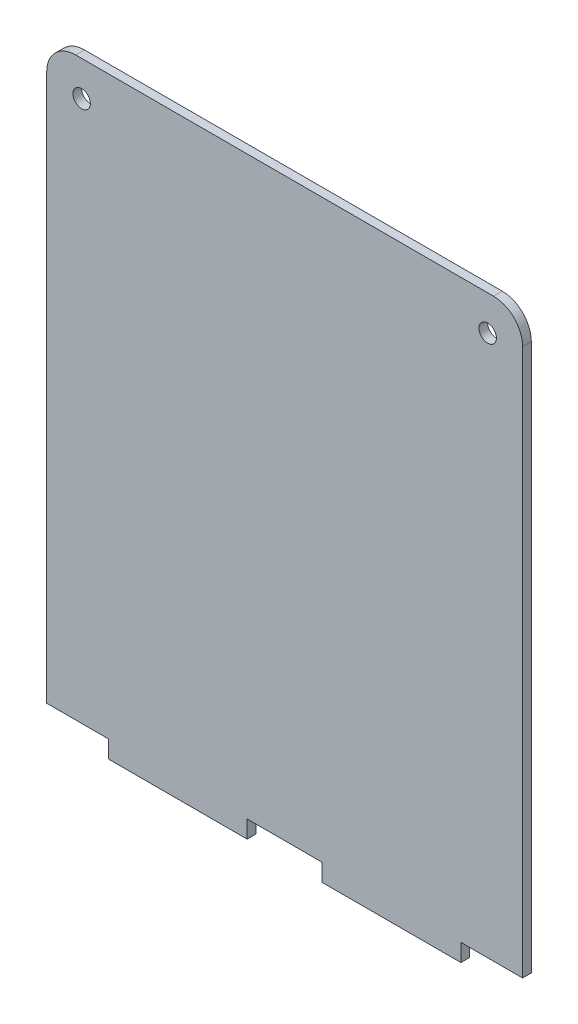
from build123d import *

# Parameters (mm, degrees)
SKETCH1_W           = 81.8
SKETCH1_H           = 102
BOSS_EXTRUDE1_DEPTH = 1.5
SKETCH2_W           = 12.89
SKETCH2_H           = 3
SKETCH2_W_2         = 10.6
SKETCH2_R           = 1.5
CUT_EXTRUDE1_DEPTH  = 131.757370729
FILLET1_R           = 5


with BuildPart() as part:
    # Sketch1 → Boss-Extrude1 (new body)
    with BuildSketch(Plane.XY):
        with Locations((40.9, 51)):
            Rectangle(SKETCH1_W, SKETCH1_H)
    extrude(amount=BOSS_EXTRUDE1_DEPTH)

    # Sketch2 → Cut-Extrude1 (cut, through all)
    with BuildSketch(Plane.XY.offset(1.5)):
        with Locations((40.9, 1.5)):
            Rectangle(SKETCH2_W, SKETCH2_H)
        with Locations((76.5, 1.5)):
            Rectangle(SKETCH2_W_2, SKETCH2_H)
        with Locations((5.3, 1.5)):
            Rectangle(SKETCH2_W_2, SKETCH2_H)
        with Locations((6, 96)):
            Circle(SKETCH2_R)
        with Locations((75.8, 96)):
            Circle(SKETCH2_R)
    extrude(amount=-CUT_EXTRUDE1_DEPTH, mode=Mode.SUBTRACT)

    # Fillet1
    fillet1_edges = [part.edges().sort_by_distance(p)[0] for p in [
        (81.8, 102, 0.75),
        (0, 102, 0.75),
    ]]
    fillet(fillet1_edges, radius=FILLET1_R)


solid = part.part
